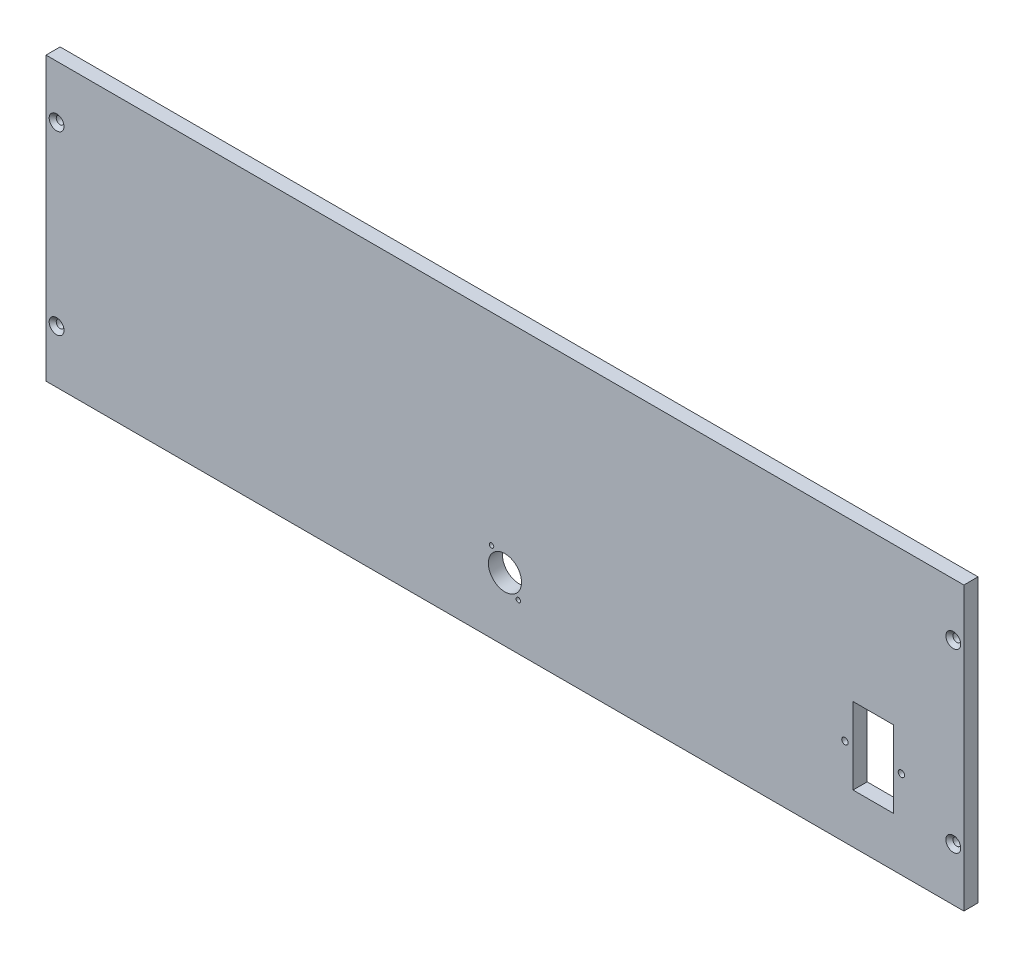
from build123d import *

# Parameters (mm, degrees)
ESQUISSE1_W             = 650
ESQUISSE1_H             = 200
BOSS_EXTRU_1_DEPTH      = 10
ESQUISSE2_R             = 2.75
ENL_V_MAT_EXTRU_1_DEPTH = 10
CHANFREIN1_SIZE         = 2.5
ESQUISSE3_R             = 1.6
ESQUISSE3_R_2           = 11.75
ESQUISSE3_W             = 28.5
ESQUISSE3_H             = 54.3
ESQUISSE3_R_3           = 2.25
ENL_V_MAT_EXTRU_2_DEPTH = 10


with BuildPart() as part:
    # Esquisse1 → Boss.-Extru.1 (new body)
    with BuildSketch(Plane.XY):
        with Locations((325, 100)):
            Rectangle(ESQUISSE1_W, ESQUISSE1_H)
    extrude(amount=BOSS_EXTRU_1_DEPTH)

    # Esquisse2 → Enlèv. mat.-Extru.1 (cut)
    with BuildSketch(Plane.XY.offset(10)):
        with Locations((7.5, 162.5)):
            Circle(ESQUISSE2_R)
        with Locations((642.5, 162.5)):
            Circle(ESQUISSE2_R)
        with Locations((7.5, 37.5)):
            Circle(ESQUISSE2_R)
        with Locations((642.5, 37.5)):
            Circle(ESQUISSE2_R)
    extrude(amount=-ENL_V_MAT_EXTRU_1_DEPTH, mode=Mode.SUBTRACT)

    # Chanfrein1
    chanfrein1_edges = [part.edges().sort_by_distance(p)[0] for p in [
        (4.75, 162.5, 10),
        (4.75, 37.5, 10),
        (639.75, 37.5, 10),
        (639.75, 162.5, 10),
    ]]
    chamfer(chanfrein1_edges, length=CHANFREIN1_SIZE)

    # Esquisse3 → Enlèv. mat.-Extru.2 (cut)
    with BuildSketch(Plane.XY.offset(10)):
        with Locations((315.499614794, 56.999404399)):
            Circle(ESQUISSE3_R)
        with Locations((325, 45)):
            Circle(ESQUISSE3_R_2)
        with Locations((334.500385206, 33.000595601)):
            Circle(ESQUISSE3_R)
        with Locations((585.75, 62.15)):
            Rectangle(ESQUISSE3_W, ESQUISSE3_H)
        with Locations((565.75, 62.15)):
            Circle(ESQUISSE3_R_3)
        with Locations((605.75, 62.15)):
            Circle(ESQUISSE3_R_3)
    extrude(amount=-ENL_V_MAT_EXTRU_2_DEPTH, mode=Mode.SUBTRACT)


solid = part.part
